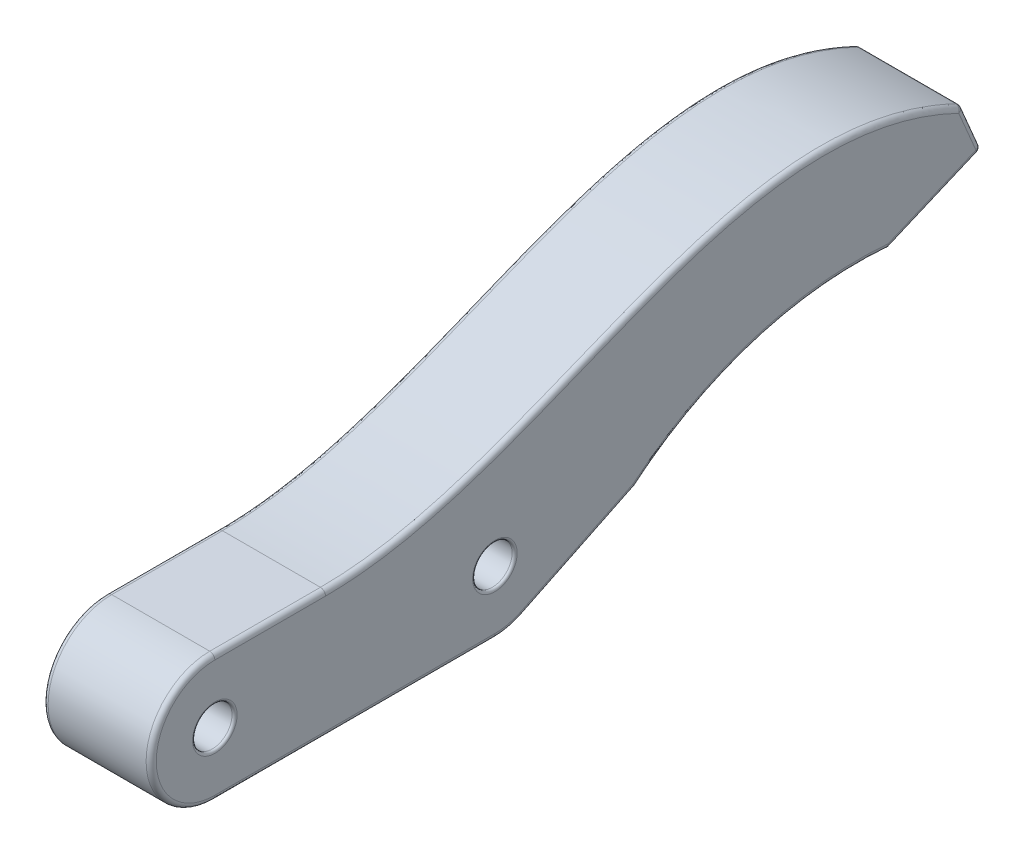
from build123d import *

# Parameters (mm, degrees)
SKETCH_1_R            = 1.75
EXTRUDE_1_DEPTH       = 8.5
EXTRUDE_2_OUTLINE_R   = 1.75
EXTRUDE_2_OUTLINE_R_2 = 1.55
EXTRUDE_2_DEPTH       = 8.5
FILLET_1_R            = 0.4
FILLET_2_R            = 0.2


# Read off the part's stored shape, not the designer's step: 凸台-拉伸2
with BuildPart() as part:
    # 草图1 → 凸台-拉伸1 (new body)
    with BuildSketch(Plane(origin=(8.5, 0, 0), x_dir=(0, 0, -1), z_dir=(1, 0, 0))):
        with BuildLine():
            Line((13.694974759, 10), (5, 10))
            ThreePointArc((5, 10), (0, 5), (5, 0))
            Line((5, 0), (27, 0))
            ThreePointArc((27, 0), (28.120410255, 0.12714859), (29.183837075, 0.502127655))
            Line((29.183837075, 0.502127655), (38.08542066, 4.824084077))
            ThreePointArc((38.08542066, 4.824084077), (47.396990541, 9.917410338), (57.948000409, 11.067843667))
            Line((57.948000409, 11.067843667), (65.313809691, 14.189518476))
            Line((65.313809691, 14.189518476), (63.752972286, 17.872423117))
            add(Edge.make_bspline(
                [(63.752972286, 17.872423117), (45.928882678, 26.563787963), (31.059268621, 10), (13.694974759, 10)],
                knots=[0, 0, 0, 0, 1, 1, 1, 1], degree=3))
        make_face()
        with Locations(Location((5, 5, 0), (0, 0, 180))):
            Circle(SKETCH_1_R, mode=Mode.SUBTRACT)
        with Locations(Location((27, 5, 0), (0, 0, 180))):
            Circle(SKETCH_1_R, mode=Mode.SUBTRACT)
    extrude(amount=-EXTRUDE_1_DEPTH)

    # 凸台-拉伸2 outline → 凸台-拉伸2 (add)
    # profile 1 of 2: a face of its own
    with BuildSketch(Plane.YZ):
        with Locations((5, -5)):
            Circle(EXTRUDE_2_OUTLINE_R)
        with Locations((5, -5)):
            Circle(EXTRUDE_2_OUTLINE_R_2, mode=Mode.SUBTRACT)
    # profile 2 of 2: a face of its own
    with BuildSketch(Plane.YZ):
        with Locations((5, -27)):
            Circle(EXTRUDE_2_OUTLINE_R)
        with Locations((5, -27)):
            Circle(EXTRUDE_2_OUTLINE_R_2, mode=Mode.SUBTRACT)
    extrude(amount=EXTRUDE_2_DEPTH)

    # 圆角1
    fillet_1_edges = [part.edges().sort_by_distance(p)[0] for p in [
        (8.5, 9.917410338, -47.396990541),
        (8.5, 2.663105866, -33.634628868),
        (8.5, 0.12714859, -28.120410255),
        (8.5, 0, -16),
        (8.5, 5, 0),
        (8.5, 10, -9.347487379),
        (8.5, 17.192155422, -38.542735392),
        (0, 5, 0),
        (4.25, 17.872423117, -63.752972286),
        (4.25, 14.189518476, -65.313809691),
        (0, 0, -16),
        (0, 0.12714859, -28.120410255),
        (0, 2.663105866, -33.634628868),
        (0, 9.917410338, -47.396990541),
        (0, 12.628681071, -61.63090505),
        (0, 16.030970797, -64.533390989),
        (0, 17.192155422, -38.542735392),
        (0, 10, -9.347487379),
        (8.5, 16.030970797, -64.533390989),
        (8.5, 12.628681071, -61.63090505),
    ]]
    fillet(fillet_1_edges, radius=FILLET_1_R)

    # 圆角2
    fillet_2_edges = [part.edges().sort_by_distance(p)[0] for p in [
        (0, 3.45, -27),
        (8.5, 3.45, -27),
        (0, 3.45, -5),
        (8.5, 3.45, -5),
    ]]
    fillet(fillet_2_edges, radius=FILLET_2_R)


solid = part.part
